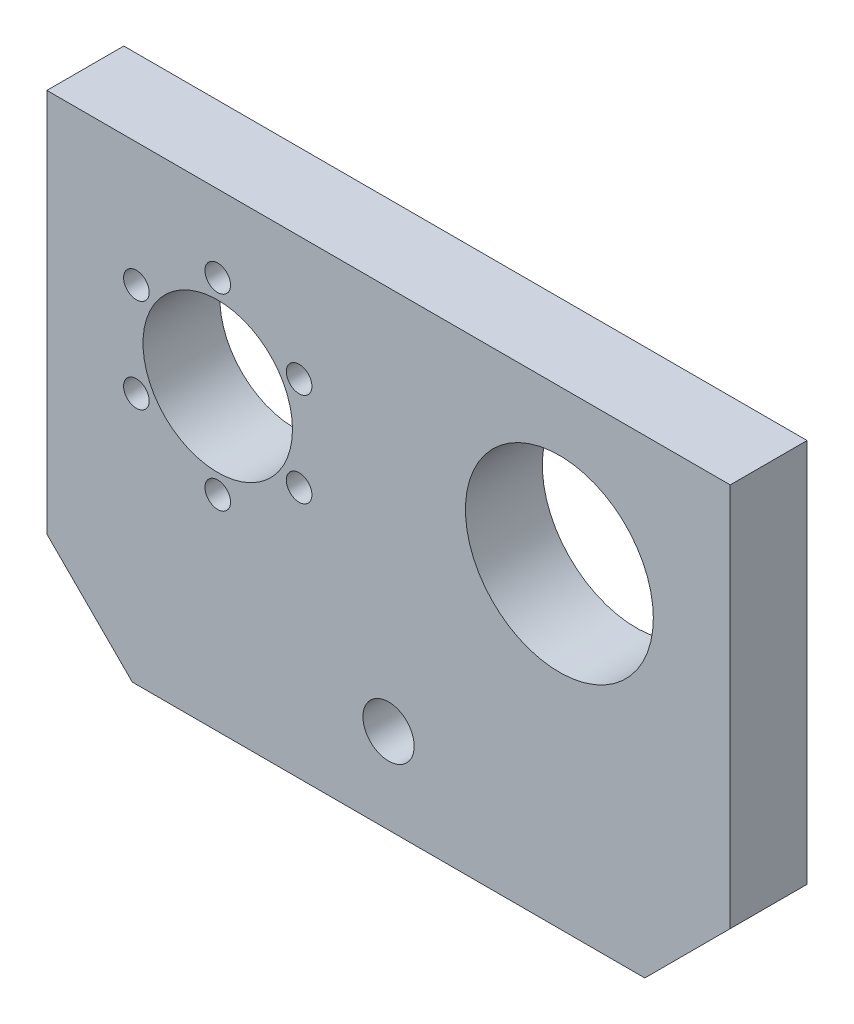
from build123d import *

# Parameters (mm, degrees)
ESQUISSE1_W             = 80
ESQUISSE1_H             = 55
BOSS_EXTRU_1_DEPTH      = 9
ESQUISSE2_R             = 11
ESQUISSE2_R_2           = 8.75
ESQUISSE2_R_3           = 1.5
ENL_V_MAT_EXTRU_1_DEPTH = 98.49871794
ESQUISSE3_R             = 3
ENL_V_MAT_EXTRU_2_DEPTH = 98.49871794
CHANFREIN1_SIZE         = 10


with BuildPart() as part:
    # Esquisse1 → Boss.-Extru.1 (new body)
    with BuildSketch(Plane.XY):
        with Locations((40, 27.5)):
            Rectangle(ESQUISSE1_W, ESQUISSE1_H)
    extrude(amount=BOSS_EXTRU_1_DEPTH)

    # Esquisse2 → Enlèv. mat.-Extru.1 (cut, through all)
    with BuildSketch(Plane.XY.offset(9)):
        with Locations((60, 37)):
            Circle(ESQUISSE2_R)
        with Locations((20, 35)):
            Circle(ESQUISSE2_R_2)
        with Locations((20, 46)):
            Circle(ESQUISSE2_R_3)
        with Locations((29.526279442, 40.5)):
            Circle(ESQUISSE2_R_3)
        with Locations((29.526279442, 29.5)):
            Circle(ESQUISSE2_R_3)
        with Locations((20, 24)):
            Circle(ESQUISSE2_R_3)
        with Locations((10.473720558, 29.5)):
            Circle(ESQUISSE2_R_3)
        with Locations((10.473720558, 40.5)):
            Circle(ESQUISSE2_R_3)
    extrude(amount=-ENL_V_MAT_EXTRU_1_DEPTH, mode=Mode.SUBTRACT)

    # Esquisse3 → Enlèv. mat.-Extru.2 (cut, through all)
    with BuildSketch(Plane.XY.offset(9)):
        with Locations((40, 10)):
            Circle(ESQUISSE3_R)
    extrude(amount=-ENL_V_MAT_EXTRU_2_DEPTH, mode=Mode.SUBTRACT)

    # Chanfrein1
    chanfrein1_edges = [part.edges().sort_by_distance(p)[0] for p in [
        (80, 0, 4.5),
        (0, 0, 4.5),
    ]]
    chamfer(chanfrein1_edges, length=CHANFREIN1_SIZE)


solid = part.part
